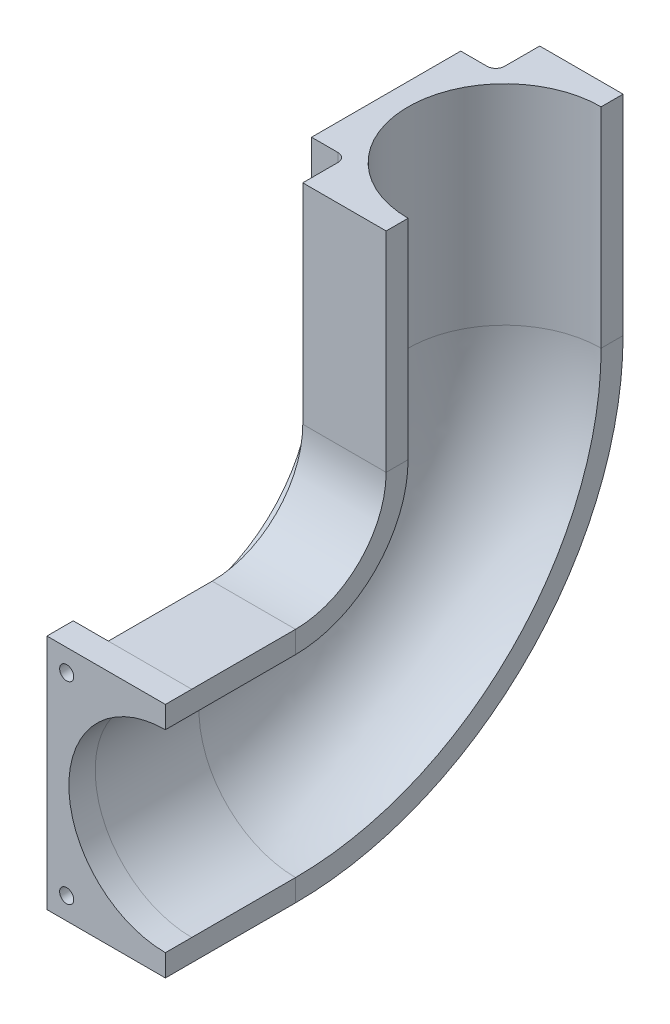
from build123d import *

# Parameters (mm, degrees)
EXTRUDE_1_DEPTH     = 6
SKETCH_4_R          = 1.605
CUT_EXTRUDE_1_DEPTH = 10


with BuildPart() as part:
    # 草图1 → 凸台-拉伸1 (new body)
    with BuildSketch(Plane.XY):
        with BuildLine():
            Line((0, 0), (-27, 0))
            Line((-27, 0), (-27, -54))
            Line((-27, -54), (0, -54))
            Line((0, -54), (0, -49))
            ThreePointArc((0, -49), (-22, -27), (0, -5))
            Line((0, -5), (0, 0))
        make_face()
    extrude(amount=-EXTRUDE_1_DEPTH)

    # 扫描1: sweep along a path in 草图3
    with BuildLine(Plane(origin=(0, 0, 0), x_dir=(0, 0, -1), z_dir=(1, 0, 0))) as sweep_1_path:
        Line((6, -27), (29.659999985, -27.000851338))
        ThreePointArc((29.659999985, -27.000851338), (63.354746468, -13.045095672), (77.311714535, 20.649148631))
        Line((77.311714535, 20.649148631), (77.311714535, 68.299148631))
    # 草图2 → 扫描1 (sweep)
    with BuildSketch(Plane(origin=(0, 0, -6), x_dir=(-1, 0, 0), z_dir=(0, 0, -1))):
        with BuildLine():
            Line((19, 0), (19, -8))
            ThreePointArc((19, -8), (19.585786438, -9.414213562), (21, -10))
            Line((21, -10), (27, -10))
            Line((27, -10), (27, -44))
            Line((27, -44), (21, -44))
            ThreePointArc((21, -44), (19.585786438, -44.585786438), (19, -46))
            Line((19, -46), (19, -54))
            Line((19, -54), (0, -54))
            Line((0, -54), (0, -49))
            ThreePointArc((0, -49), (22, -27), (0, -5))
            Line((0, -5), (0, 0))
            Line((0, 0), (19, 0))
        make_face()
    sweep(path=sweep_1_path.line)

    # 草图4 → 切除-拉伸1 (cut)
    with BuildSketch(Plane(origin=(0, 0, -6), x_dir=(-1, 0, 0), z_dir=(0, 0, -1))):
        with Locations((22.5, -5)):
            Circle(SKETCH_4_R)
    cut_extrude_1 = extrude(amount=-CUT_EXTRUDE_1_DEPTH, mode=Mode.SUBTRACT)

    # 镜向1: 切除-拉伸1 across plane
    add(cut_extrude_1.mirror(Plane.ZX.offset(-27)), mode=Mode.SUBTRACT)


solid = part.part
